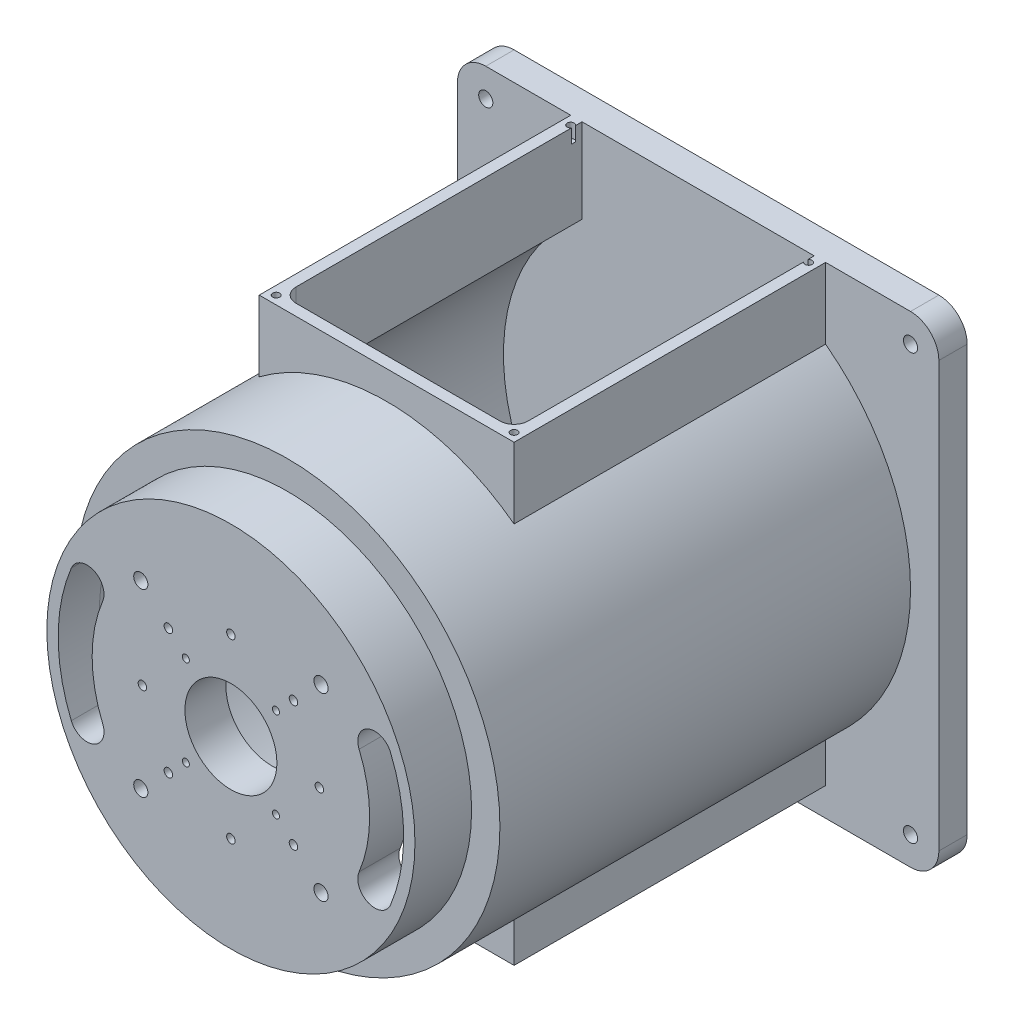
from build123d import *

# Parameters (mm, degrees)
BOSS_EXTRUDE1_DEPTH   = 20
BOSS_EXTRUDE2_DEPTH   = 220
BOSS_EXTRUDE3_DEPTH   = 70
SKETCH4_R             = 130
BOSS_EXTRUDE4_DEPTH   = 40
SKETCH18_R            = 137.5
CUT_EXTRUDE6_DEPTH    = 256
BODY_MOVE_COPY1_ANGLE = 90
BODY_MOVE_COPY2_ANGLE = 90
BODY_MOVE_COPY3_ANGLE = 180
SKETCH19_R            = 32.5
CUT_EXTRUDE7_DEPTH    = 74
CUT_EXTRUDE8_DEPTH    = 20
CUT_EXTRUDE11_START   = -74
CUT_EXTRUDE11_DEPTH   = 74
SKETCH29_R            = 122.5
SKETCH29_R_2          = 32.5
CUT_EXTRUDE12_DEPTH   = 45
CUT_EXTRUDE13_START   = -320
CUT_EXTRUDE13_DEPTH   = 320
SKETCH35_R            = 2.5
CUT_EXTRUDE14_DEPTH   = 10
CUT_EXTRUDE15_START   = -10
SKETCH36_R            = 2.5
CUT_EXTRUDE15_DEPTH   = 10
SKETCH37_R            = 5
SKETCH37_R_2          = 3
SKETCH37_R_3          = 2.5
CUT_EXTRUDE16_DEPTH   = 29


# Read off the part's stored shape, not the designer's step: Cut-Extrude13
with BuildPart() as part:
    # Sketch1 → Boss-Extrude1 (new body)
    with BuildSketch(Plane(origin=(0, 0, 0), x_dir=(1, 0, 0), z_dir=(0, 1, 0))):
        with BuildLine():
            Line((150, -170), (-150, -170))
            ThreePointArc((-150, -170), (-164.142135624, -164.142135624), (-170, -150))
            Line((-170, -150), (-170, 150))
            ThreePointArc((-170, 150), (-164.142135624, 164.142135624), (-150, 170))
            Line((-150, 170), (150, 170))
            ThreePointArc((150, 170), (164.142135624, 164.142135624), (170, 150))
            Line((170, 150), (170, -150))
            ThreePointArc((170, -150), (164.142135624, -164.142135624), (150, -170))
        make_face()
    extrude(amount=BOSS_EXTRUDE1_DEPTH)

    # Sketch2 → Boss-Extrude2 (add)
    with BuildSketch(Plane(origin=(0, 20, 0), x_dir=(1, 0, 0), z_dir=(0, 1, 0))):
        with BuildLine():
            Line((170, -90), (170, 90))
            Line((170, 90), (120, 90))
            ThreePointArc((120, 90), (0, 150), (-120, 90))
            Line((-120, 90), (-150, 90))
            Line((-150, 90), (-150, -90))
            Line((-150, -90), (-120, -90))
            ThreePointArc((-120, -90), (0, -150), (120, -90))
            Line((120, -90), (170, -90))
        make_face()
    extrude(amount=BOSS_EXTRUDE2_DEPTH)

    # Sketch3 → Boss-Extrude3 (add)
    with BuildSketch(Plane(origin=(0, 240, 0), x_dir=(1, 0, 0), z_dir=(0, 1, 0))):
        with BuildLine():
            ThreePointArc((-120, -90), (0, -150), (120, -90))
            ThreePointArc((120, -90), (142.302494708, -47.434164903), (150, 0))
            ThreePointArc((150, 0), (142.302494708, 47.434164903), (120, 90))
            ThreePointArc((120, 90), (0, 150), (-120, 90))
            ThreePointArc((-120, 90), (-142.302494685, 47.43416497), (-150, 1.43e-07))
            ThreePointArc((-150, 1.43e-07), (-142.30249473, -47.434164835), (-120, -90))
        make_face()
    extrude(amount=BOSS_EXTRUDE3_DEPTH)

    # Sketch4 → Boss-Extrude4 (add)
    with BuildSketch(Plane(origin=(0, 310, 0), x_dir=(1, 0, 0), z_dir=(0, 1, 0))):
        with Locations(Location((0, 0, 0), (0, 0, 270))):
            Circle(SKETCH4_R)
    extrude(amount=BOSS_EXTRUDE4_DEPTH)

    # Sketch18 → Cut-Extrude6 (cut)
    with BuildSketch(Plane(origin=(0, 20, 0), x_dir=(1, 0, 0), z_dir=(0, 1, 0))):
        with Locations(Location((0, 0, 0), (0, 0, 270))):
            Circle(SKETCH18_R)
    extrude(amount=CUT_EXTRUDE6_DEPTH, mode=Mode.SUBTRACT)


with BuildPart() as part_1:
    # Body-Move/Copy1: moved
    add(part.part.rotate(Axis((0, 0, 0), (1, 0, 0)), BODY_MOVE_COPY1_ANGLE))


with BuildPart() as part_2:
    # Body-Move/Copy2: moved
    add(part_1.part.rotate(Axis((0, 0, 0), (0, 0, -1)), BODY_MOVE_COPY2_ANGLE))


with BuildPart() as part_3:
    # Body-Move/Copy3: moved
    add(part_2.part.rotate(Axis((0, 0, 0), (0, 0, 1)), BODY_MOVE_COPY3_ANGLE))

    # Sketch19 → Cut-Extrude7 (cut)
    with BuildSketch(Plane.XY.offset(350)):
        Circle(SKETCH19_R)
    extrude(amount=-CUT_EXTRUDE7_DEPTH, mode=Mode.SUBTRACT)

    # Sketch20 → Cut-Extrude8 (cut)
    with BuildSketch(Plane(origin=(0, 0, 0), x_dir=(-1, 0, 0), z_dir=(0, 0, -1))):
        with BuildLine():
            ThreePointArc((155, -150), (153.535533906, -146.464466094), (150, -145))
            Line((150, -145), (150, -150))
            Line((150, -150), (145, -150))
            ThreePointArc((145, -150), (150, -155), (155, -150))
        make_face()
        with BuildLine():
            Line((150, -150), (150, -145))
            ThreePointArc((150, -145), (146.464466094, -146.464466094), (145, -150))
            Line((145, -150), (150, -150))
        make_face()
        with BuildLine():
            ThreePointArc((155, -150), (153.535533906, -146.464466094), (150, -145))
            Line((150, -145), (150, -150))
            Line((150, -150), (145, -150))
            ThreePointArc((145, -150), (150, -155), (155, -150))
        make_face()
        with BuildLine():
            Line((150, -150), (150, -145))
            ThreePointArc((150, -145), (146.464466094, -146.464466094), (145, -150))
            Line((145, -150), (150, -150))
        make_face()
        with BuildLine():
            ThreePointArc((-145, -150), (-146.464466094, -146.464466094), (-150, -145))
            Line((-150, -145), (-150, -150))
            Line((-150, -150), (-145, -150))
        make_face()
        with BuildLine():
            Line((-150, -150), (-150, -145))
            ThreePointArc((-150, -145), (-153.535533906, -153.535533906), (-145, -150))
            Line((-145, -150), (-150, -150))
        make_face()
        with BuildLine():
            ThreePointArc((-145, -150), (-146.464466094, -146.464466094), (-150, -145))
            Line((-150, -145), (-150, -150))
            Line((-150, -150), (-145, -150))
        make_face()
        with BuildLine():
            Line((-150, -150), (-150, -145))
            ThreePointArc((-150, -145), (-153.535533906, -153.535533906), (-145, -150))
            Line((-145, -150), (-150, -150))
        make_face()
        with BuildLine():
            Line((-150, 145), (-150, 150))
            Line((-150, 150), (-145, 150))
            ThreePointArc((-145, 150), (-153.535533906, 153.535533906), (-150, 145))
        make_face()
        with BuildLine():
            Line((-145, 150), (-150, 150))
            Line((-150, 150), (-150, 145))
            ThreePointArc((-150, 145), (-146.464466094, 146.464466094), (-145, 150))
        make_face()
        with BuildLine():
            Line((-150, 145), (-150, 150))
            Line((-150, 150), (-145, 150))
            ThreePointArc((-145, 150), (-153.535533906, 153.535533906), (-150, 145))
        make_face()
        with BuildLine():
            Line((-145, 150), (-150, 150))
            Line((-150, 150), (-150, 145))
            ThreePointArc((-150, 145), (-146.464466094, 146.464466094), (-145, 150))
        make_face()
        with BuildLine():
            ThreePointArc((155, 150), (150, 155), (145, 150))
            Line((145, 150), (150, 150))
            Line((150, 150), (150, 145))
            ThreePointArc((150, 145), (153.535533906, 146.464466094), (155, 150))
        make_face()
        with BuildLine():
            Line((150, 150), (145, 150))
            ThreePointArc((145, 150), (146.464466094, 146.464466094), (150, 145))
            Line((150, 145), (150, 150))
        make_face()
        with BuildLine():
            ThreePointArc((155, 150), (150, 155), (145, 150))
            Line((145, 150), (150, 150))
            Line((150, 150), (150, 145))
            ThreePointArc((150, 145), (153.535533906, 146.464466094), (155, 150))
        make_face()
        with BuildLine():
            Line((150, 150), (145, 150))
            ThreePointArc((145, 150), (146.464466094, 146.464466094), (150, 145))
            Line((150, 145), (150, 150))
        make_face()
    extrude(amount=-CUT_EXTRUDE8_DEPTH, mode=Mode.SUBTRACT)

    # Sketch26 → Cut-Extrude11 (cut)
    with BuildSketch(Plane.XY.offset(350).offset(CUT_EXTRUDE11_START)):
        with BuildLine():
            ThreePointArc((90.540194176, 37.502976396), (98, -2.47e-07), (90.540193987, -37.502976852))
            ThreePointArc((90.540193987, -37.502976852), (97.034547528, -53.181732008), (112.713302884, -46.687378949))
            ThreePointArc((112.713302884, -46.687378949), (122, -4.91e-07), (112.713303259, 46.687378042))
            ThreePointArc((112.713303259, 46.687378042), (97.034547753, 53.181732102), (90.540194176, 37.502976396))
        make_face()
    cut_extrude11 = extrude(amount=CUT_EXTRUDE11_DEPTH, mode=Mode.SUBTRACT)

    # Sketch29 → Cut-Extrude12 (cut)
    # profile 1 of 2: a face of its own
    with BuildSketch(Plane(origin=(0, 0, 276), x_dir=(-1, 0, 0), z_dir=(0, 0, -1))):
        Circle(SKETCH29_R)
        with Locations(Location((0, 0, 0), (0, 0, 180))):
            Circle(SKETCH29_R_2, mode=Mode.SUBTRACT)
    # profile 2 of 2: a face of its own
    with BuildSketch(Plane(origin=(0, 0, 276), x_dir=(-1, 0, 0), z_dir=(0, 0, -1))):
        with BuildLine():
            ThreePointArc((-90.540194186, 37.502976372), (-98, 0), (-90.540194186, -37.502976372))
            ThreePointArc((-90.540194186, -37.502976372), (-97.034547388, -53.18173195), (-112.713302966, -46.687378749))
            ThreePointArc((-112.713302966, -46.687378749), (-122, 0), (-112.713302966, 46.687378749))
            ThreePointArc((-112.713302966, 46.687378749), (-97.034547388, 53.18173195), (-90.540194186, 37.502976372))
        make_face()
    extrude(amount=-CUT_EXTRUDE12_DEPTH, mode=Mode.SUBTRACT)

    # Mirror1: Cut-Extrude11 across plane
    add(cut_extrude11.mirror(Plane(origin=(0, 0, 0), x_dir=(0, 0, 1), z_dir=(1, 0, 0))), mode=Mode.SUBTRACT)

    # Cut-Extrude13 outline → Cut-Extrude13 (cut)
    with BuildSketch(Plane.XZ.offset(150).offset(CUT_EXTRUDE13_START)):
        with BuildLine():
            Line((-82, 222), (-82, 20))
            Line((-82, 20), (82, 20))
            Line((82, 20), (82, 222))
            ThreePointArc((82, 222), (79.071067812, 229.071067812), (72, 232))
            Line((72, 232), (-72, 232))
            ThreePointArc((-72, 232), (-79.071067812, 229.071067812), (-82, 222))
        make_face()
    extrude(amount=CUT_EXTRUDE13_DEPTH, mode=Mode.SUBTRACT)

    # Sketch35 → Cut-Extrude14 (cut)
    with BuildSketch(Plane(origin=(0, 170, 0), x_dir=(1, 0, 0), z_dir=(0, 1, 0))):
        with Locations(Location((-84, -234, 0), (0, 0, 180))):
            Circle(SKETCH35_R)
        with Locations((-84, -26)):
            Circle(SKETCH35_R)
        with Locations((84, -26)):
            Circle(SKETCH35_R)
        with Locations(Location((84, -234, 0), (0, 0, 180))):
            Circle(SKETCH35_R)
    extrude(amount=-CUT_EXTRUDE14_DEPTH, mode=Mode.SUBTRACT)

    # Sketch36 → Cut-Extrude15 (cut)
    with BuildSketch(Plane.XZ.offset(150).offset(CUT_EXTRUDE15_START)):
        with BuildLine():
            ThreePointArc((-81.5, 234), (-82.232233047, 235.767766953), (-84, 236.5))
            Line((-84, 236.5), (-84, 234))
            Line((-84, 234), (-86.5, 234))
            ThreePointArc((-86.5, 234), (-84, 231.5), (-81.5, 234))
        make_face()
        with BuildLine():
            Line((-84, 234), (-84, 236.5))
            ThreePointArc((-84, 236.5), (-85.767766953, 235.767766953), (-86.5, 234))
            Line((-86.5, 234), (-84, 234))
        make_face()
        with BuildLine():
            ThreePointArc((-81.5, 234), (-82.232233047, 235.767766953), (-84, 236.5))
            Line((-84, 236.5), (-84, 234))
            Line((-84, 234), (-86.5, 234))
            ThreePointArc((-86.5, 234), (-84, 231.5), (-81.5, 234))
        make_face()
        with BuildLine():
            Line((-84, 234), (-84, 236.5))
            ThreePointArc((-84, 236.5), (-85.767766953, 235.767766953), (-86.5, 234))
            Line((-86.5, 234), (-84, 234))
        make_face()
        with Locations(Location((84, 234, 0), (0, 0, 180))):
            Circle(SKETCH36_R)
        with BuildLine():
            ThreePointArc((82, 27.5), (81.5, 26), (82, 24.5))
            Line((82, 24.5), (82, 27.5))
        make_face()
        with BuildLine():
            Line((82, 27.5), (82, 24.5))
            ThreePointArc((82, 24.5), (84.790569415, 23.628291755), (86.5, 26))
            ThreePointArc((86.5, 26), (84.790569415, 28.371708245), (82, 27.5))
        make_face()
        with BuildLine():
            ThreePointArc((82, 27.5), (81.5, 26), (82, 24.5))
            Line((82, 24.5), (82, 27.5))
        make_face()
        with BuildLine():
            Line((82, 27.5), (82, 24.5))
            ThreePointArc((82, 24.5), (84.790569415, 23.628291755), (86.5, 26))
            ThreePointArc((86.5, 26), (84.790569415, 28.371708245), (82, 27.5))
        make_face()
        with BuildLine():
            ThreePointArc((-82, 27.5), (-84.790569415, 28.371708245), (-86.5, 26))
            Line((-86.5, 26), (-84, 26))
            Line((-84, 26), (-84, 23.5))
            ThreePointArc((-84, 23.5), (-82.881966011, 23.763932022), (-82, 24.5))
            Line((-82, 24.5), (-82, 27.5))
        make_face()
        with BuildLine():
            Line((-84, 26), (-86.5, 26))
            ThreePointArc((-86.5, 26), (-85.767766953, 24.232233047), (-84, 23.5))
            Line((-84, 23.5), (-84, 26))
        make_face()
        with BuildLine():
            ThreePointArc((-81.5, 26), (-81.628291755, 26.790569415), (-82, 27.5))
            Line((-82, 27.5), (-82, 24.5))
            ThreePointArc((-82, 24.5), (-81.628291755, 25.209430585), (-81.5, 26))
        make_face()
    extrude(amount=CUT_EXTRUDE15_DEPTH, mode=Mode.SUBTRACT)

    # Sketch37 → Cut-Extrude16 (cut)
    with BuildSketch(Plane.XY.offset(350)):
        with Locations((63.639610307, -63.639610307)):
            Circle(SKETCH37_R)
        with Locations((44.194173824, -44.194173824)):
            Circle(SKETCH37_R_2)
        with Locations((31.819805153, -31.819805153)):
            Circle(SKETCH37_R_3)
        with Locations((-63.639610307, -63.639610307)):
            Circle(SKETCH37_R)
        with Locations((-63.639610307, 63.639610307)):
            Circle(SKETCH37_R)
        with Locations((63.639610307, 63.639610307)):
            Circle(SKETCH37_R)
        with Locations((0, -62.5)):
            Circle(SKETCH37_R_2)
        with Locations((-44.194173824, -44.194173824)):
            Circle(SKETCH37_R_2)
        with Locations((-62.5, 0)):
            Circle(SKETCH37_R_2)
        with Locations((-44.194173824, 44.194173824)):
            Circle(SKETCH37_R_2)
        with Locations((0, 62.5)):
            Circle(SKETCH37_R_2)
        with Locations((44.194173824, 44.194173824)):
            Circle(SKETCH37_R_2)
        with Locations((62.5, 0)):
            Circle(SKETCH37_R_2)
        with Locations((-31.819805153, -31.819805153)):
            Circle(SKETCH37_R_3)
        with Locations((-31.819805153, 31.819805153)):
            Circle(SKETCH37_R_3)
        with Locations((31.819805153, 31.819805153)):
            Circle(SKETCH37_R_3)
    extrude(amount=-CUT_EXTRUDE16_DEPTH, mode=Mode.SUBTRACT)


solid = part_3.part
